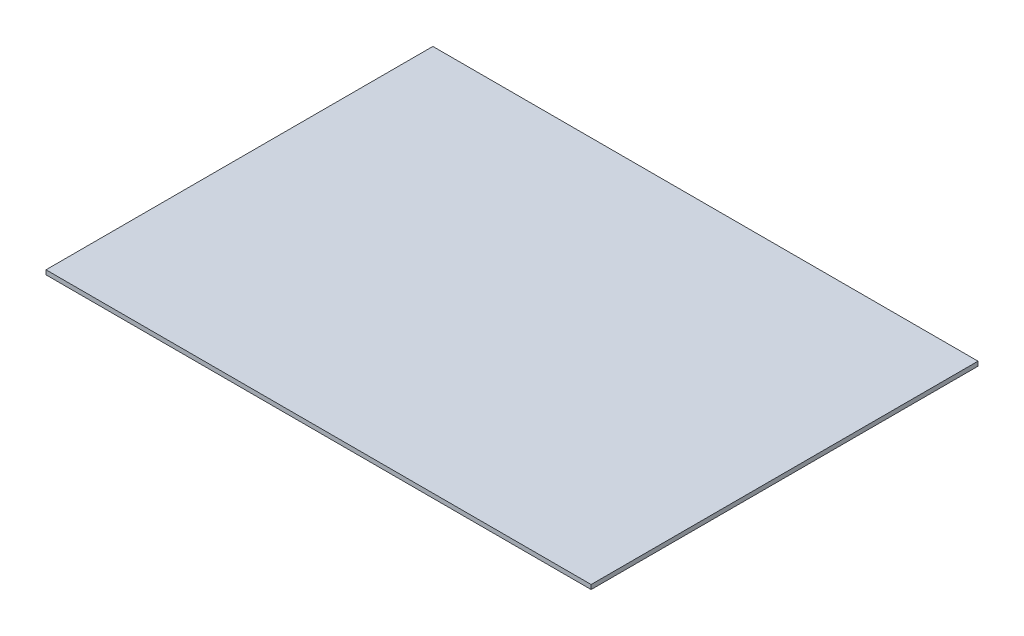
from build123d import *

# Parameters (mm, degrees)
SKETCH1_W           = 393.7
SKETCH1_H           = 279.4
BOSS_EXTRUDE1_DEPTH = 3.175


with BuildPart() as part:
    # Sketch1 → Boss-Extrude1 (new body)
    with BuildSketch(Plane(origin=(0, 0, 0), x_dir=(1, 0, 0), z_dir=(0, 1, 0))):
        with Locations((196.85, 139.7)):
            Rectangle(SKETCH1_W, SKETCH1_H)
    extrude(amount=BOSS_EXTRUDE1_DEPTH)


solid = part.part
